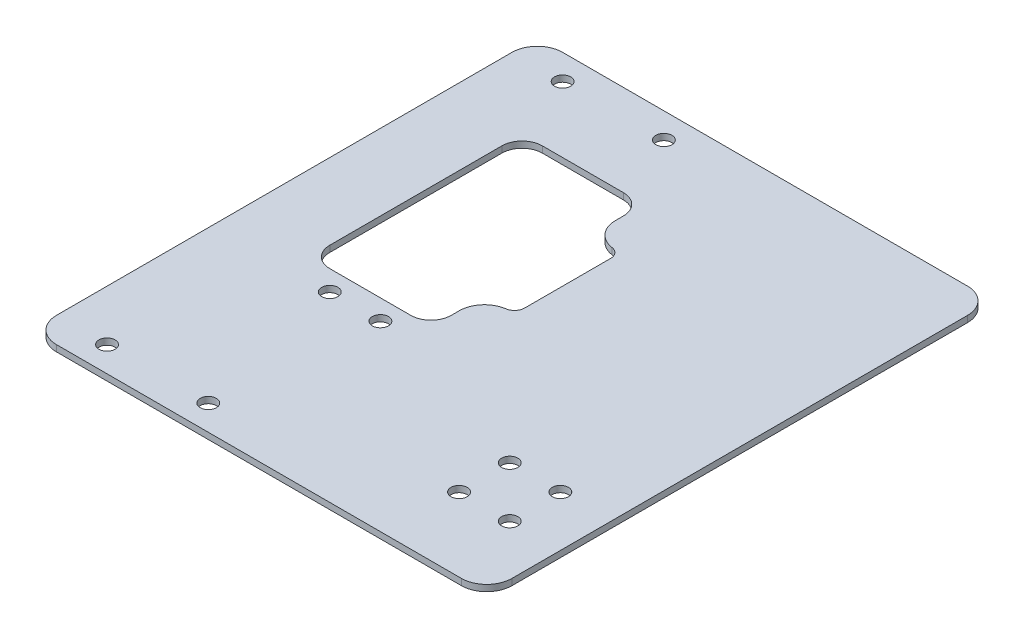
from build123d import *

# Parameters (mm, degrees)
SKETCH1_W           = 368.3
SKETCH1_H           = 127
SKETCH1_R           = 2.032
BOSS_EXTRUDE1_DEPTH = 1.5875
SKETCH2_W           = 254
SKETCH2_H           = 127
SKETCH2_R           = 2.032
CUT_EXTRUDE1_DEPTH  = 195.797311727
FILLET1_R           = 5.08
FILLET4_R           = 2.54
FILLET5_R           = 6.35
FILLET6_R           = 6.35


with BuildPart() as part:
    # Sketch1 → Boss-Extrude1 (new body)
    with BuildSketch(Plane(origin=(0, 0, 0), x_dir=(1, 0, 0), z_dir=(0, 1, 0))):
        Rectangle(SKETCH1_W, SKETCH1_H)
        with Locations((-171.45, -57.15)):
            Circle(SKETCH1_R, mode=Mode.SUBTRACT)
        with Locations((-146.05, -57.15)):
            Circle(SKETCH1_R, mode=Mode.SUBTRACT)
        with Locations((-95.25, -45.0215)):
            Circle(SKETCH1_R, mode=Mode.SUBTRACT)
        with Locations((-95.25, -32.3215)):
            Circle(SKETCH1_R, mode=Mode.SUBTRACT)
        with Locations((-82.55, -45.0215)):
            Circle(SKETCH1_R, mode=Mode.SUBTRACT)
        with Locations((-82.55, -32.3215)):
            Circle(SKETCH1_R, mode=Mode.SUBTRACT)
        with Locations((-154.94, -17.78)):
            Circle(SKETCH1_R, mode=Mode.SUBTRACT)
        with Locations((-142.24, -17.78)):
            Circle(SKETCH1_R, mode=Mode.SUBTRACT)
        with Locations((146.05, -57.15)):
            Circle(SKETCH1_R, mode=Mode.SUBTRACT)
        with Locations((171.45, -57.15)):
            Circle(SKETCH1_R, mode=Mode.SUBTRACT)
        Polygon((-134.62, -12.7), (-165.1, -12.7), (-165.1, 40.64), (-134.62, 40.64), (-134.62, 27.305), (-127, 27.305), (-127, 0.635), (-134.62, 0.635), align=None, mode=Mode.SUBTRACT)
        with Locations((-171.45, 57.15)):
            Circle(SKETCH1_R, mode=Mode.SUBTRACT)
        with Locations((-146.05, 57.15)):
            Circle(SKETCH1_R, mode=Mode.SUBTRACT)
        with Locations((146.05, 57.15)):
            Circle(SKETCH1_R, mode=Mode.SUBTRACT)
        with Locations((171.45, 57.15)):
            Circle(SKETCH1_R, mode=Mode.SUBTRACT)
    extrude(amount=BOSS_EXTRUDE1_DEPTH)

    # Sketch2 → Cut-Extrude1 (cut, through all)
    with BuildSketch(Plane(origin=(0, 1.5875, 0), x_dir=(1, 0, 0), z_dir=(0, 1, 0))):
        with Locations((57.15, 0)):
            Rectangle(SKETCH2_W, SKETCH2_H)
        with Locations((146.05, -57.15)):
            Circle(SKETCH2_R, mode=Mode.SUBTRACT)
        with Locations((171.45, -57.15)):
            Circle(SKETCH2_R, mode=Mode.SUBTRACT)
        with Locations((146.05, 57.15)):
            Circle(SKETCH2_R, mode=Mode.SUBTRACT)
        with Locations((171.45, 57.15)):
            Circle(SKETCH2_R, mode=Mode.SUBTRACT)
    extrude(amount=-CUT_EXTRUDE1_DEPTH, mode=Mode.SUBTRACT)

    # Fillet1
    fillet1_edges = [part.edges().sort_by_distance(p)[0] for p in [
        (-134.62, 0.79375, 12.7),
        (-165.1, 0.79375, 12.7),
        (-165.1, 0.79375, -40.64),
        (-134.62, 0.79375, -40.64),
    ]]
    fillet(fillet1_edges, radius=FILLET1_R)

    # Fillet4
    fillet4_edges = [part.edges().sort_by_distance(p)[0] for p in [
        (-127, 0.79375, -0.635),
        (-127, 0.79375, -27.305),
    ]]
    fillet(fillet4_edges, radius=FILLET4_R)

    # Fillet5
    fillet5_edges = [part.edges().sort_by_distance(p)[0] for p in [
        (-134.62, 0.79375, -0.635),
        (-134.62, 0.79375, -27.305),
    ]]
    fillet(fillet5_edges, radius=FILLET5_R)

    # Fillet6
    fillet6_edges = [part.edges().sort_by_distance(p)[0] for p in [
        (-184.15, 0.79375, -63.5),
        (-184.15, 0.79375, 63.5),
        (-69.85, 0.79375, -63.5),
        (-69.85, 0.79375, 63.5),
    ]]
    fillet(fillet6_edges, radius=FILLET6_R)


solid = part.part
